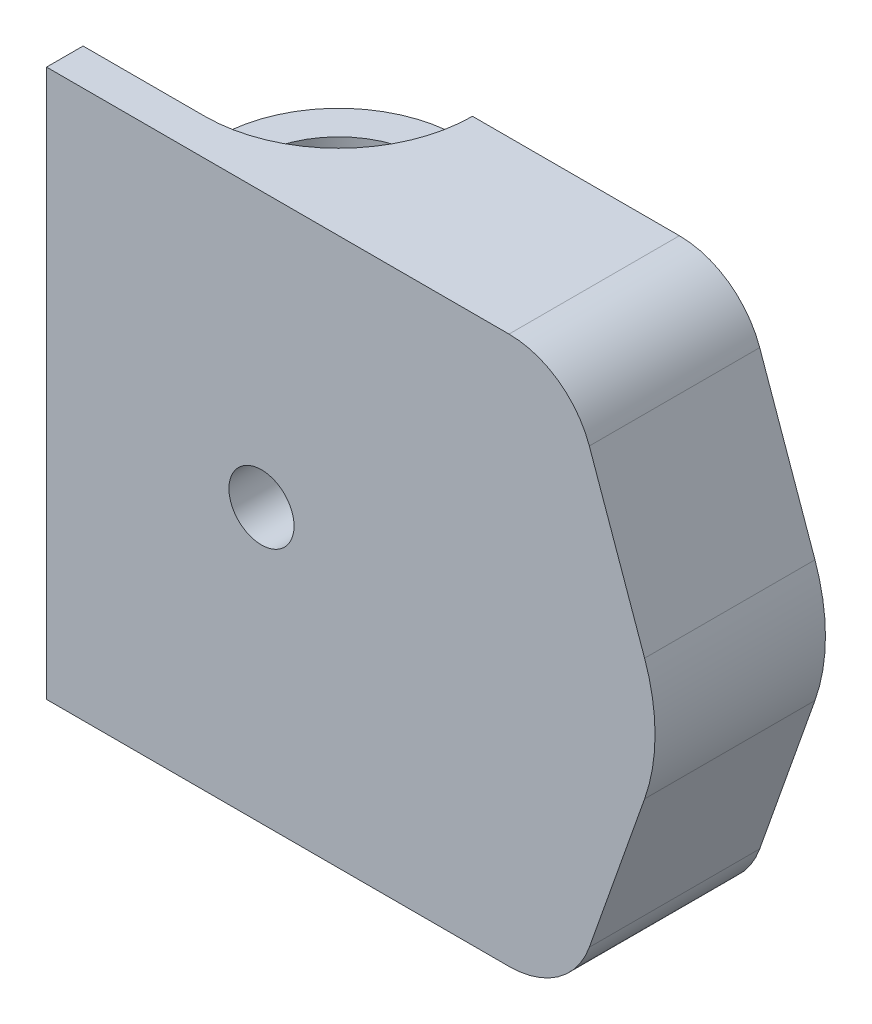
from build123d import *

# Parameters (mm, degrees)
SKETCH1_R            = 2.675
BOSS_EXTRUDE6_DEPTH  = 10
BOSS_EXTRUDE8_START  = -21
BOSS_EXTRUDE8_DEPTH  = 21
SKETCH10_R           = 3.5
CUT_EXTRUDE5_DEPTH   = 191.966382811
SKETCH11_R           = 7.125
CUT_EXTRUDE6_DEPTH   = 5
CUT_EXTRUDE7_START   = -5
SKETCH12_R           = 7.125
CUT_EXTRUDE7_DEPTH   = 5
BOSS_EXTRUDE9_DEPTH  = 5
BOSS_EXTRUDE11_DEPTH = 12
BOSS_EXTRUDE13_START = 12
BOSS_EXTRUDE13_DEPTH = 12
SKETCH18_R           = 6.75
CUT_EXTRUDE11_DEPTH  = 1.67
CUT_EXTRUDE13_DEPTH  = 191.966382811
CUT_EXTRUDE14_DEPTH  = 191.966382811
CUT_EXTRUDE10_DEPTH  = 213.509902322
SKETCH26_R           = 2.675
BOSS_EXTRUDE14_DEPTH = 5
SKETCH27_R           = 2.675
BOSS_EXTRUDE15_DEPTH = 5
SKETCH30_R           = 2.675
CUT_EXTRUDE15_DEPTH  = 10
BOSS_EXTRUDE16_START = 1.67
SKETCH31_R           = 6.75
BOSS_EXTRUDE16_DEPTH = 1.67
SKETCH32_R           = 6.75
BOSS_EXTRUDE17_DEPTH = 2
SKETCH34_R           = 6.35
BOSS_EXTRUDE18_DEPTH = 1.5
SKETCH35_R           = 2.675
BOSS_EXTRUDE19_DEPTH = 4
CUT_EXTRUDE16_DEPTH  = 12
CUT_EXTRUDE17_DEPTH  = 12
FILLET1_R            = 10


with BuildPart() as part:
    # Sketch1 → Boss-Extrude6 (new body)
    with BuildSketch(Plane.XY):
        with BuildLine():
            Line((182.426294195, 92.707675116), (186.967804891, 79.877060143))
            ThreePointArc((186.967804891, 79.877060143), (187.827472336, 74.871963218), (186.967804891, 69.866866293))
            Line((186.967804891, 69.866866293), (182.426294195, 57.03625132))
            ThreePointArc((182.426294195, 57.03625132), (179.86789414, 53.655758914), (175.827472336, 52.371963218))
            Line((175.827472336, 52.371963218), (157.827472336, 52.371963218))
            Line((157.827472336, 52.371963218), (157.827472336, 64.371963218))
            Line((157.827472336, 64.371963218), (137.827472336, 64.371963218))
            Line((137.827472336, 64.371963218), (137.827472336, 85.371963218))
            Line((137.827472336, 85.371963218), (157.827472336, 85.371963218))
            Line((157.827472336, 85.371963218), (157.827472336, 97.371963218))
            Line((157.827472336, 97.371963218), (175.827472336, 97.371963218))
            ThreePointArc((175.827472336, 97.371963218), (179.86789414, 96.088167522), (182.426294195, 92.707675116))
        make_face()
        with Locations((155.487472336, 74.871963218)):
            Circle(SKETCH1_R, mode=Mode.SUBTRACT)
    extrude(amount=BOSS_EXTRUDE6_DEPTH)

    # Sketch9 → Boss-Extrude8 (add)
    with BuildSketch(Plane(origin=(0, 85.371963218, 0), x_dir=(1, 0, 0), z_dir=(0, 1, 0)).offset(BOSS_EXTRUDE8_START)):
        with BuildLine():
            Line((137.827472336, 0), (157.827472336, 0))
            ThreePointArc((157.827472336, 0), (154.893165251, 7.076438626), (147.81227561, 9.999988453))
            Line((147.81227561, 9.999988453), (137.827472336, 9.999988453))
            Line((137.827472336, 9.999988453), (137.827472336, 0))
        make_face()
    extrude(amount=BOSS_EXTRUDE8_DEPTH)

    # Sketch10 → Cut-Extrude5 (cut, through all)
    with BuildSketch(Plane(origin=(0, 85.371963218, 0), x_dir=(1, 0, 0), z_dir=(0, 1, 0))):
        with Locations(Location((147.827472336, 0, 0), (0, 0, 270))):
            Circle(SKETCH10_R)
    extrude(amount=-CUT_EXTRUDE5_DEPTH, mode=Mode.SUBTRACT)

    # Sketch11 → Cut-Extrude6 (cut)
    with BuildSketch(Plane(origin=(0, 85.371963218, 0), x_dir=(1, 0, 0), z_dir=(0, 1, 0))):
        with Locations(Location((147.827472336, 0, 0), (0, 0, 270))):
            Circle(SKETCH11_R)
    extrude(amount=-CUT_EXTRUDE6_DEPTH, mode=Mode.SUBTRACT)

    # Sketch12 → Cut-Extrude7 (cut)
    with BuildSketch(Plane.XZ.offset(-64.371963218).offset(CUT_EXTRUDE7_START)):
        with Locations(Location((147.827472336, 0, 0), (0, 0, 90))):
            Circle(SKETCH12_R)
    extrude(amount=CUT_EXTRUDE7_DEPTH, mode=Mode.SUBTRACT)

    # Sketch15 → Boss-Extrude9 (add)
    with BuildSketch(Plane.XY.offset(10)):
        Polygon((157.89790971, 79.046963218), (153.077034962, 79.046963218), (150.666597588, 74.871963218), (153.077034962, 70.696963218), (157.89790971, 70.696963218), (160.308347084, 74.871963218), align=None)
    extrude(amount=-BOSS_EXTRUDE9_DEPTH)

    # Sketch19 → Boss-Extrude11 (add)
    with BuildSketch(Plane(origin=(0, 85.371963218, 0), x_dir=(1, 0, 0), z_dir=(0, 1, 0))):
        with BuildLine():
            Line((157.827472336, -4.582575695), (157.827472336, -10))
            Line((157.827472336, -10), (152.410048031, -10))
            ThreePointArc((152.410048031, -10), (155.605646929, -7.778174593), (157.827472336, -4.582575695))
        make_face()
    extrude(amount=BOSS_EXTRUDE11_DEPTH)

    # Sketch21 → Boss-Extrude13 (add)
    with BuildSketch(Plane.XZ.offset(-64.371963218).offset(BOSS_EXTRUDE13_START)):
        with BuildLine():
            Line((157.827472336, 4.582575695), (157.827472336, 10))
            Line((157.827472336, 10), (152.410048031, 10))
            ThreePointArc((152.410048031, 10), (155.605646929, 7.778174593), (157.827472336, 4.582575695))
        make_face()
    extrude(amount=-BOSS_EXTRUDE13_DEPTH)

    # Sketch18 → Cut-Extrude11 (cut)
    with BuildSketch(Plane(origin=(0, 0, 0), x_dir=(-1, 0, 0), z_dir=(0, 0, -1))):
        with Locations((-173.633919606, 74.871963218)):
            Circle(SKETCH18_R)
    extrude(amount=-CUT_EXTRUDE11_DEPTH, mode=Mode.SUBTRACT)

    # Sketch23 → Cut-Extrude13 (cut, through all)
    with BuildSketch(Plane.XZ.offset(-64.371963218)):
        with BuildLine():
            Line((157.827472336, 4.582575695), (157.827472336, 0))
            Line((157.827472336, 0), (158.827472336, 0))
            ThreePointArc((158.827472336, 0), (158.574564966, 2.34520788), (157.827472336, 4.582575695))
        make_face()
    extrude(amount=CUT_EXTRUDE13_DEPTH, mode=Mode.SUBTRACT)

    # Sketch24 → Cut-Extrude14 (cut, through all)
    with BuildSketch(Plane(origin=(0, 85.371963218, 0), x_dir=(1, 0, 0), z_dir=(0, 1, 0))):
        with BuildLine():
            Line((157.827472336, -4.582575695), (157.827472336, 0))
            Line((157.827472336, 0), (158.827472336, 0))
            ThreePointArc((158.827472336, 0), (158.574564966, -2.34520788), (157.827472336, -4.582575695))
        make_face()
    extrude(amount=CUT_EXTRUDE14_DEPTH, mode=Mode.SUBTRACT)

    # Sketch14 → Cut-Extrude10 (cut, through all)
    with BuildSketch(Plane.XY.offset(10)):
        Polygon((157.89790971, 79.046963218), (153.077034962, 79.046963218), (150.666597588, 74.871963218), (153.077034962, 70.696963218), (157.89790971, 70.696963218), (160.308347084, 74.871963218), align=None)
    extrude(amount=-CUT_EXTRUDE10_DEPTH, mode=Mode.SUBTRACT)

    # Sketch26 → Boss-Extrude14 (add)
    with BuildSketch(Plane.XY.offset(10)):
        Polygon((153.077034962, 79.046963218), (150.666597588, 74.871963218), (153.077034962, 70.696963218), (157.89790971, 70.696963218), (160.308347084, 74.871963218), (157.89790971, 79.046963218), align=None)
        with Locations((155.487472336, 74.871963218)):
            Circle(SKETCH26_R, mode=Mode.SUBTRACT)
    extrude(amount=-BOSS_EXTRUDE14_DEPTH)

    # Sketch27 → Boss-Extrude15 (add)
    with BuildSketch(Plane.XY.offset(10)):
        with Locations((155.487472336, 74.871963218)):
            Circle(SKETCH27_R)
    extrude(amount=-BOSS_EXTRUDE15_DEPTH)

    # Sketch30 → Cut-Extrude15 (cut)
    with BuildSketch(Plane(origin=(0, 0, 5), x_dir=(-1, 0, 0), z_dir=(0, 0, -1))):
        with Locations((-155.487472336, 74.871963218)):
            Circle(SKETCH30_R)
    extrude(amount=-CUT_EXTRUDE15_DEPTH, mode=Mode.SUBTRACT)

    # Sketch31 → Boss-Extrude16 (add)
    with BuildSketch(Plane(origin=(0, 0, 1.67), x_dir=(-1, 0, 0), z_dir=(0, 0, -1)).offset(BOSS_EXTRUDE16_START)):
        with BuildLine():
            Line((-157.827472336, 85.371963218), (-158.827472336, 85.371963218))
            Line((-158.827472336, 85.371963218), (-158.827472336, 97.371963218))
            Line((-158.827472336, 97.371963218), (-175.827472336, 97.371963218))
            ThreePointArc((-175.827472336, 97.371963218), (-179.86789414, 96.088167522), (-182.426294195, 92.707675116))
            Line((-182.426294195, 92.707675116), (-186.967804891, 79.877060143))
            ThreePointArc((-186.967804891, 79.877060143), (-187.827472336, 74.871963218), (-186.967804891, 69.866866293))
            Line((-186.967804891, 69.866866293), (-182.426294195, 57.03625132))
            ThreePointArc((-182.426294195, 57.03625132), (-179.86789414, 53.655758914), (-175.827472336, 52.371963218))
            Line((-175.827472336, 52.371963218), (-158.827472336, 52.371963218))
            Line((-158.827472336, 52.371963218), (-158.827472336, 64.371963218))
            Line((-158.827472336, 64.371963218), (-157.827472336, 64.371963218))
            Line((-157.827472336, 64.371963218), (-157.827472336, 70.696963218))
            Line((-157.827472336, 70.696963218), (-157.89790971, 70.696963218))
            Line((-157.89790971, 70.696963218), (-160.308347084, 74.871963218))
            Line((-160.308347084, 74.871963218), (-157.89790971, 79.046963218))
            Line((-157.89790971, 79.046963218), (-157.827472336, 79.046963218))
            Line((-157.827472336, 79.046963218), (-157.827472336, 85.371963218))
        make_face()
        with Locations((-173.633919606, 74.871963218)):
            Circle(SKETCH31_R, mode=Mode.SUBTRACT)
    extrude(amount=-BOSS_EXTRUDE16_DEPTH)

    # Sketch32 → Boss-Extrude17 (add)
    with BuildSketch(Plane(origin=(0, 0, 0), x_dir=(-1, 0, 0), z_dir=(0, 0, -1))):
        with Locations((-173.633919606, 74.871963218)):
            Circle(SKETCH32_R)
    extrude(amount=-BOSS_EXTRUDE17_DEPTH)

    # Sketch34 → Boss-Extrude18 (add)
    with BuildSketch(Plane(origin=(0, 0, 0), x_dir=(-1, 0, 0), z_dir=(0, 0, -1))):
        with Locations(Location((-173.633919606, 74.871963218, 0), (0, 0, 180))):
            Circle(SKETCH34_R)
    extrude(amount=BOSS_EXTRUDE18_DEPTH)

    # Sketch35 → Boss-Extrude19 (add)
    with BuildSketch(Plane.XY.offset(10)):
        with BuildLine():
            Line((137.827472336, 85.371963218), (137.827472336, 64.371963218))
            Line((137.827472336, 64.371963218), (137.827472336, 52.371963218))
            Line((137.827472336, 52.371963218), (175.827472336, 52.371963218))
            ThreePointArc((175.827472336, 52.371963218), (179.86789414, 53.655758914), (182.426294195, 57.03625132))
            Line((182.426294195, 57.03625132), (186.967804891, 69.866866293))
            ThreePointArc((186.967804891, 69.866866293), (187.827472336, 74.871963218), (186.967804891, 79.877060143))
            Line((186.967804891, 79.877060143), (182.426294195, 92.707675116))
            ThreePointArc((182.426294195, 92.707675116), (179.86789414, 96.088167522), (175.827472336, 97.371963218))
            Line((175.827472336, 97.371963218), (137.827472336, 97.371963218))
            Line((137.827472336, 97.371963218), (137.827472336, 85.371963218))
        make_face()
        with Locations(Location((155.487472336, 74.871963218, 0), (0, 0, 180))):
            Circle(SKETCH35_R, mode=Mode.SUBTRACT)
    extrude(amount=BOSS_EXTRUDE19_DEPTH)

    # Sketch36 → Cut-Extrude16 (cut)
    with BuildSketch(Plane(origin=(0, 97.371963218, 0), x_dir=(1, 0, 0), z_dir=(0, 1, 0))):
        with BuildLine():
            Line((147.827472336, -11), (137.827472336, -11))
            Line((137.827472336, -11), (137.827472336, -10))
            Line((137.827472336, -10), (152.410048031, -10))
            ThreePointArc((152.410048031, -10), (150.172680216, -10.74709263), (147.827472336, -11))
        make_face()
    extrude(amount=-CUT_EXTRUDE16_DEPTH, mode=Mode.SUBTRACT)

    # Sketch38 → Cut-Extrude17 (cut)
    with BuildSketch(Plane.XZ.offset(-52.371963218)):
        with BuildLine():
            Line((147.827472336, 11), (137.827472336, 11))
            Line((137.827472336, 11), (137.827472336, 10))
            Line((137.827472336, 10), (152.410048031, 10))
            ThreePointArc((152.410048031, 10), (150.172680216, 10.74709263), (147.827472336, 11))
        make_face()
    extrude(amount=-CUT_EXTRUDE17_DEPTH, mode=Mode.SUBTRACT)

    # Fillet1
    # the kernel refuses this fillet: 10 mm, written as the material it takes off along each edge
    with BuildSketch(Plane(origin=(137.827472336, 39.371963218, -9.999988453), x_dir=(0.9999999999993333, 0, -1.1547030050344039e-06), z_dir=(0, 1, 0))) as fillet1_piece_1:
        with BuildLine():
            CenterArc((9.999988453, -10), FILLET1_R, 89.99993384, 90)
            Line((-1.1547e-05, -9.999988453), (-1.000011547, -9.999987298))
            Line((-1.000011547, -9.999987298), (-1, 1.155e-06))
            Line((-1, 1.155e-06), (1.155e-06, 1))
            ThreePointArc((1.155e-06, 1), (9.983284757, 0.999987318), (10.000001155, 1))
            Line((10.000001155, 1), (10, 0))
        make_face()
    extrude(amount=71, mode=Mode.SUBTRACT)


solid = part.part
